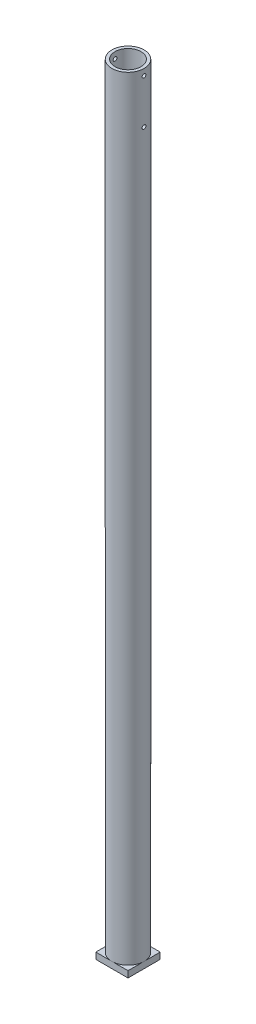
from build123d import *

# Parameters (mm, degrees)
SKETCH1_R               = 12.7
SKETCH1_R_2             = 10.287
BOSS_EXTRUDE1_DEPTH     = 609.6
CUT_EXTRUDE1_DEPTH      = 20
CUT_EXTRUDE1_DEPTH_BACK = 20
SKETCH2_R               = 1.5
BOSS_EXTRUDE2_START     = -5
SKETCH3_W               = 25.4
SKETCH3_H               = 25.4
SKETCH3_R               = 10.287
BOSS_EXTRUDE2_DEPTH     = 5


with BuildPart() as part:
    # Sketch1 → Boss-Extrude1 (new body)
    with BuildSketch(Plane(origin=(0, 0, 0), x_dir=(1, 0, 0), z_dir=(0, 1, 0))):
        Circle(SKETCH1_R)
        Circle(SKETCH1_R_2, mode=Mode.SUBTRACT)
    extrude(amount=BOSS_EXTRUDE1_DEPTH)

    # Sketch2 → Cut-Extrude1 (cut, two sides: drawn at the far end of the back side and taken through both)
    with BuildSketch(Plane(origin=(0, 0, 0), x_dir=(0, 0, -1), z_dir=(1, 0, 0)).offset(-CUT_EXTRUDE1_DEPTH_BACK)):
        with Locations((0, 604.6)):
            Circle(SKETCH2_R)
        with Locations((0, 569.6)):
            Circle(SKETCH2_R)
    extrude(amount=CUT_EXTRUDE1_DEPTH + CUT_EXTRUDE1_DEPTH_BACK, mode=Mode.SUBTRACT)

    # Sketch3 → Boss-Extrude2 (add)
    with BuildSketch(Plane(origin=(0, 0, 0), x_dir=(1, 0, 0), z_dir=(0, 1, 0)).offset(BOSS_EXTRUDE2_START)):
        Rectangle(SKETCH3_W, SKETCH3_H)
        Circle(SKETCH3_R, mode=Mode.SUBTRACT)
    extrude(amount=BOSS_EXTRUDE2_DEPTH)


solid = part.part
